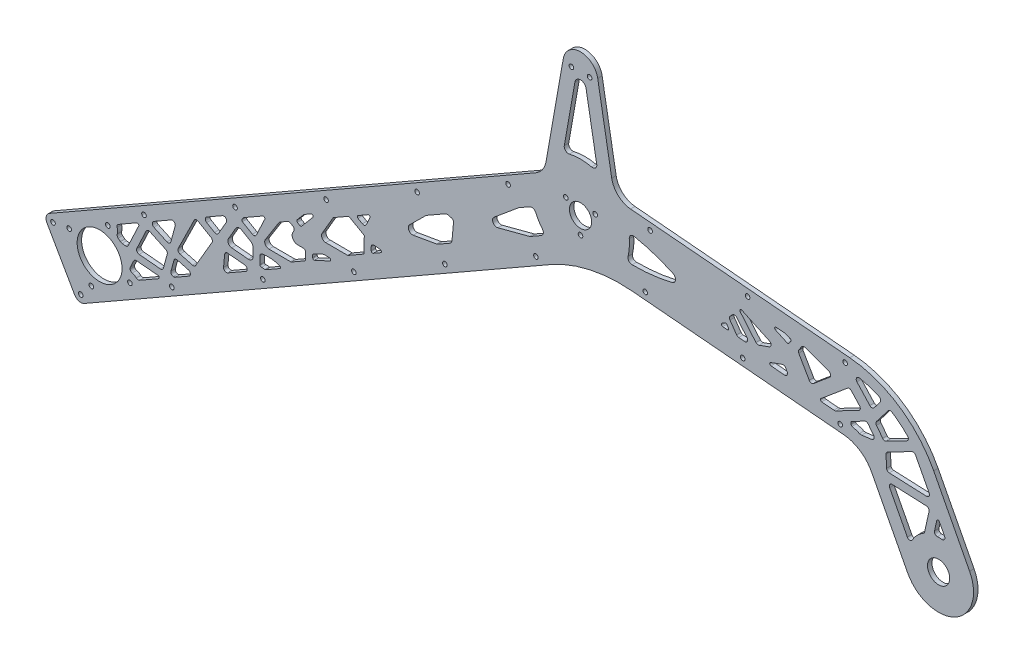
from build123d import *

# Parameters (mm, degrees)
SKETCH2_R              = 7.9375
SKETCH2_R_2            = 16.05
SKETCH2_R_3            = 1.65
BASE_DEPTH             = 3.175
SKETCH3_R              = 1.65
STRUT_HOLES_DEPTH      = 448.434897902
LIGHTENING_HOLES_DEPTH = 448.434897902
SKETCH7_R              = 1.65
CUT_EXTRUDE1_DEPTH     = 448.434897902


with BuildPart() as part:
    # Sketch2 → Base (new body)
    with BuildSketch(Plane.XY):
        with BuildLine():
            Line((-379.716809958, -188.506893436), (-32.006532147, 10.487277971))
            ThreePointArc((-32.006532147, 10.487277971), (-27.186230121, 14.879084252), (-24.685038782, 20.901319377))
            Line((-24.685038782, 20.901319377), (-12.310096913, 91.083102221))
            ThreePointArc((-12.310096913, 91.083102221), (0, 101.4125), (12.310096913, 91.083102221))
            Line((12.310096913, 91.083102221), (22.322003955, 34.302755831))
            ThreePointArc((22.322003955, 34.302755831), (26.960267136, 25.848318444), (35.786784109, 21.964558025))
            Line((35.786784109, 21.964558025), (192.586144941, 8.246391504))
            ThreePointArc((192.586144941, 8.246391504), (227.717231711, -4.10798993), (252.575276723, -31.83706486))
            Line((252.575276723, -31.83706486), (278.255270829, -81.167874559))
            ThreePointArc((278.255270829, -81.167874559), (267.623715331, -114.886860719), (233.904729171, -104.255305221))
            Line((233.904729171, -104.255305221), (208.224735064, -54.924495522))
            ThreePointArc((208.224735064, -54.924495522), (199.93872006, -45.681470545), (188.228357804, -41.563343401))
            Line((188.228357804, -41.563343401), (36.823729736, -28.317154839))
            ThreePointArc((36.823729736, -28.317154839), (6.649577682, -30.266109959), (-21.562664076, -41.144864173))
            Line((-21.562664076, -41.144864173), (-354.881400189, -231.902773674))
            ThreePointArc((-354.881400189, -231.902773674), (-358.677364619, -232.387866435), (-361.70452919, -230.046726627))
            Line((-361.70452919, -230.046726627), (-381.572857005, -195.330022437))
            ThreePointArc((-381.572857005, -195.330022437), (-382.057949767, -191.534058007), (-379.716809958, -188.506893436))
        make_face()
        Circle(SKETCH2_R, mode=Mode.SUBTRACT)
        with Locations((-343.92, -196.825)):
            Circle(SKETCH2_R_2, mode=Mode.SUBTRACT)
        with Locations((-6.5, 88.9125)):
            Circle(SKETCH2_R_3, mode=Mode.SUBTRACT)
        with Locations((6.5, 88.9125)):
            Circle(SKETCH2_R_3, mode=Mode.SUBTRACT)
        with Locations((256.08, -92.71158989)):
            Circle(SKETCH2_R, mode=Mode.SUBTRACT)
        with Locations((-365.631063534, -190.919094461)):
            Circle(SKETCH2_R_3, mode=Mode.SUBTRACT)
        with Locations((-338.014094461, -175.113936466)):
            Circle(SKETCH2_R_3, mode=Mode.SUBTRACT)
        with Locations((-322.208936466, -202.730905539)):
            Circle(SKETCH2_R_3, mode=Mode.SUBTRACT)
        with Locations((-349.825905539, -218.536063534)):
            Circle(SKETCH2_R_3, mode=Mode.SUBTRACT)
    extrude(amount=BASE_DEPTH)

    # Sketch3 → Strut Holes (cut, through all)
    with BuildSketch(Plane.XY.offset(3.175)):
        with Locations((-357.364941166, -227.56318565)):
            Circle(SKETCH3_R)
        with Locations((-292.27112081, -190.310070996)):
            Circle(SKETCH3_R)
        with Locations((-227.177300453, -153.056956343)):
            Circle(SKETCH3_R)
        with Locations((-162.083480097, -115.803841689)):
            Circle(SKETCH3_R)
        with Locations((-96.98965974, -78.550727035)):
            Circle(SKETCH3_R)
        with Locations((-31.895839384, -41.297612382)):
            Circle(SKETCH3_R)
        with Locations((-312.139448625, -155.593366806)):
            Circle(SKETCH3_R)
        with Locations((-377.233268981, -192.84648146)):
            Circle(SKETCH3_R)
        with Locations((-247.045628268, -118.340252152)):
            Circle(SKETCH3_R)
        with Locations((-181.951807912, -81.087137499)):
            Circle(SKETCH3_R)
        with Locations((-116.857987555, -43.834022845)):
            Circle(SKETCH3_R)
        with Locations((-51.764167199, -6.580908192)):
            Circle(SKETCH3_R)
        with Locations((46.269308527, -24.124436716)):
            Circle(SKETCH3_R)
        with Locations((116.002937393, -30.225338708)):
            Circle(SKETCH3_R)
        with Locations((185.73656626, -36.326240701)):
            Circle(SKETCH3_R)
        with Locations((189.222795969, 3.521547223)):
            Circle(SKETCH3_R)
        with Locations((119.489167103, 9.622449215)):
            Circle(SKETCH3_R)
        with Locations((49.755538237, 15.723351208)):
            Circle(SKETCH3_R)
    extrude(amount=-STRUT_HOLES_DEPTH, mode=Mode.SUBTRACT)

    # Sketch6 → Lightening Holes (cut, through all)
    with BuildSketch(Plane.XY.offset(3.175)):
        with BuildLine():
            Line((-315.269185897, -197.710920307), (-301.759255291, -189.979203363))
            ThreePointArc((-301.759255291, -189.979203363), (-301.27885272, -188.89855459), (-302.165025934, -188.115429161))
            Line((-302.165025934, -188.115429161), (-317.529091672, -186.71244549))
            ThreePointArc((-317.529091672, -186.71244549), (-318.704383169, -186.968323474), (-319.520360019, -187.852045956))
            Line((-319.520360019, -187.852045956), (-321.920665487, -192.94890269))
            ThreePointArc((-321.920665487, -192.94890269), (-322.086706026, -193.488507205), (-322.095332893, -194.053014132))
            ThreePointArc((-322.095332893, -194.053014132), (-322.08483495, -194.136958475), (-322.074659882, -194.220942566))
            ThreePointArc((-322.074659882, -194.220942566), (-321.584640098, -195.311697425), (-320.559879114, -195.927920176))
            ThreePointArc((-320.559879114, -195.927920176), (-318.977814459, -196.521247692), (-317.584009883, -197.476378529))
            ThreePointArc((-317.584009883, -197.476378529), (-316.464213346, -197.964897395), (-315.269185897, -197.710920307))
        make_face()
        with BuildLine():
            Line((-289.844978396, -183.160677107), (-279.93882887, -177.491399715))
            ThreePointArc((-279.93882887, -177.491399715), (-278.948378644, -175.502042811), (-280.407275879, -173.825692191))
            Line((-280.407275879, -173.825692191), (-288.292322007, -171.680779414))
            ThreePointArc((-288.292322007, -171.680779414), (-289.810707779, -171.874816518), (-290.747163702, -173.085682346))
            Line((-290.747163702, -173.085682346), (-292.868560549, -180.884280112))
            ThreePointArc((-292.868560549, -180.884280112), (-292.613471256, -182.502456625), (-291.234784363, -183.387209827))
            ThreePointArc((-291.234784363, -183.387209827), (-291.195764259, -183.393163574), (-291.156778347, -183.399337252))
            ThreePointArc((-291.156778347, -183.399337252), (-290.480404568, -183.392541824), (-289.844978396, -183.160677107))
        make_face()
        with BuildLine():
            Line((-225.068253149, -146.0890356), (-215.065938543, -140.36472305))
            ThreePointArc((-215.065938543, -140.36472305), (-214.567033215, -139.40324417), (-215.236329185, -138.55154524))
            ThreePointArc((-215.236329185, -138.55154524), (-221.331874052, -137.268264968), (-227.555460503, -137.531793255))
            ThreePointArc((-227.555460503, -137.531793255), (-228.747493021, -138.209832448), (-229.222550686, -139.49630005))
            Line((-229.222550686, -139.49630005), (-229.243920799, -145.124584195))
            ThreePointArc((-229.243920799, -145.124584195), (-228.903638362, -145.87990104), (-228.110599563, -146.11945299))
            ThreePointArc((-228.110599563, -146.11945299), (-226.935128796, -146.061146676), (-225.766503733, -146.200597789))
            ThreePointArc((-225.766503733, -146.200597789), (-225.407188584, -146.208593442), (-225.068253149, -146.0890356))
        make_face()
        with BuildLine():
            Line((-202.41887229, -105.511400104), (-200.686234771, -106.520529682))
            ThreePointArc((-200.686234771, -106.520529682), (-200.013042452, -106.64186894), (-199.419351845, -106.302100524))
            Line((-199.419351845, -106.302100524), (-191.360868047, -96.772094027))
            ThreePointArc((-191.360868047, -96.772094027), (-191.355986863, -95.486528074), (-192.621174572, -95.258484862))
            Line((-192.621174572, -95.258484862), (-197.478989202, -98.038606299))
            ThreePointArc((-197.478989202, -98.038606299), (-197.765321596, -98.237482482), (-198.01276947, -98.483058387))
            Line((-198.01276947, -98.483058387), (-202.679186023, -104.001587826))
            ThreePointArc((-202.679186023, -104.001587826), (-202.901047671, -104.817187109), (-202.41887229, -105.511400104))
        make_face()
        with BuildLine():
            Line((-330.425499061, -170.667183769), (-317.378257487, -163.200263197))
            ThreePointArc((-317.378257487, -163.200263197), (-316.203164595, -163.333473919), (-315.976852671, -164.494237166))
            Line((-315.976852671, -164.494237166), (-323.402158767, -180.26128093))
            ThreePointArc((-323.402158767, -180.26128093), (-324.218135617, -181.145003412), (-325.393427114, -181.400881396))
            Line((-325.393427114, -181.400881396), (-327.826064744, -181.178742873))
            ThreePointArc((-327.826064744, -181.178742873), (-328.456346912, -181.014705953), (-329.000507167, -180.656860539))
            ThreePointArc((-329.000507167, -180.656860539), (-329.788551481, -179.963737807), (-330.608754561, -179.308986045))
            ThreePointArc((-330.608754561, -179.308986045), (-331.300981929, -178.333954341), (-331.313186478, -177.138246768))
            ThreePointArc((-331.313186478, -177.138246768), (-331.014233087, -175.069882607), (-331.339196402, -173.005445087))
            ThreePointArc((-331.339196402, -173.005445087), (-331.294912573, -171.675100882), (-330.425499061, -170.667183769))
        make_face()
        with BuildLine():
            Line((-295.53330948, -171.631597975), (-298.296173769, -181.788333758))
            ThreePointArc((-298.296173769, -181.788333758), (-299.085121934, -182.906012266), (-300.407921189, -183.255077571))
            Line((-300.407921189, -183.255077571), (-315.662540801, -181.862088072))
            ThreePointArc((-315.662540801, -181.862088072), (-317.216500905, -180.86379127), (-317.290058936, -179.018262152))
            Line((-317.290058936, -179.018262152), (-310.641451377, -164.900475625))
            ThreePointArc((-310.641451377, -164.900475625), (-309.508957679, -163.870619434), (-307.979945409, -163.943195111))
            Line((-307.979945409, -163.943195111), (-296.611069066, -169.297235353))
            ThreePointArc((-296.611069066, -169.297235353), (-295.647370018, -170.26828046), (-295.53330948, -171.631597975))
        make_face()
        with BuildLine():
            Line((-292.778723285, -149.121979529), (-305.215642876, -156.239613568))
            ThreePointArc((-305.215642876, -156.239613568), (-306.220639762, -158.055100377), (-305.074339213, -159.784842018))
            Line((-305.074339213, -159.784842018), (-295.766029178, -164.168482495))
            ThreePointArc((-295.766029178, -164.168482495), (-294.075568316, -164.17490103), (-292.984044137, -162.884058635))
            Line((-292.984044137, -162.884058635), (-289.85543458, -151.38278412))
            ThreePointArc((-289.85543458, -151.38278412), (-290.561768266, -149.275742292), (-292.778723285, -149.121979529))
        make_face()
        with BuildLine():
            Line((-286.412158457, -167.010536912), (-277.477694151, -169.440915421))
            ThreePointArc((-277.477694151, -169.440915421), (-276.194379154, -169.361694864), (-275.224483334, -168.5176123))
            Line((-275.224483334, -168.5176123), (-263.487039881, -148.364863469))
            ThreePointArc((-263.487039881, -148.364863469), (-263.281478176, -146.847994939), (-264.208712124, -145.63005284))
            Line((-264.208712124, -145.63005284), (-273.491108909, -140.223762697))
            ThreePointArc((-273.491108909, -140.223762697), (-275.075155334, -140.037188202), (-276.291924346, -141.06844292))
            Line((-276.291924346, -141.06844292), (-287.68143532, -164.197103385))
            ThreePointArc((-287.68143532, -164.197103385), (-287.710247586, -165.903135064), (-286.412158457, -167.010536912))
        make_face()
        with BuildLine():
            Line((-267.326941544, -134.555955625), (-255.981699002, -128.063087041))
            ThreePointArc((-255.981699002, -128.063087041), (-253.568709634, -128.390088491), (-253.260041176, -130.805491443))
            Line((-253.260041176, -130.805491443), (-258.957478514, -140.587777008))
            ThreePointArc((-258.957478514, -140.587777008), (-260.175420613, -141.515010956), (-261.692289142, -141.309449251))
            Line((-261.692289142, -141.309449251), (-267.340094346, -138.02003227))
            ThreePointArc((-267.340094346, -138.02003227), (-268.333510737, -136.284197061), (-267.326941544, -134.555955625))
        make_face()
        with BuildLine():
            Line((-255.261313261, -159.742391016), (-254.488576255, -151.280152708))
            ThreePointArc((-254.488576255, -151.280152708), (-253.776611846, -149.925068788), (-252.314987955, -149.470314621))
            Line((-252.314987955, -149.470314621), (-240.229659184, -150.573897437))
            ThreePointArc((-240.229659184, -150.573897437), (-238.457312757, -152.140148294), (-239.418117899, -154.30144584))
            Line((-239.418117899, -154.30144584), (-252.276183677, -161.660101332))
            ThreePointArc((-252.276183677, -161.660101332), (-254.350596062, -161.606956723), (-255.261313261, -159.742391016))
        make_face()
        with BuildLine():
            Line((-246.540160509, -131.189393308), (-251.794794147, -140.211401578))
            ThreePointArc((-251.794794147, -140.211401578), (-251.868704934, -143.096387582), (-249.475244653, -144.708825158))
            Line((-249.475244653, -144.708825158), (-237.508018237, -145.801623349))
            ThreePointArc((-237.508018237, -145.801623349), (-235.21684764, -145.033565045), (-234.235227202, -142.825444219))
            Line((-234.235227202, -142.825444219), (-234.211718457, -136.633904573))
            ThreePointArc((-234.211718457, -136.633904573), (-234.607944018, -135.132389326), (-235.701843043, -134.030151758))
            Line((-235.701843043, -134.030151758), (-242.437944567, -130.106884943))
            ThreePointArc((-242.437944567, -130.106884943), (-244.713247361, -129.798542386), (-246.540160509, -131.189393308))
        make_face()
        with BuildLine():
            Line((-241.753564235, -124.719255848), (-234.63976684, -128.862501783))
            ThreePointArc((-234.63976684, -128.862501783), (-233.039032694, -129.043963991), (-231.823804406, -127.986373074))
            Line((-231.823804406, -127.986373074), (-225.796901327, -115.1887263))
            ThreePointArc((-225.796901327, -115.1887263), (-226.023213251, -114.027963054), (-227.198306143, -113.894752332))
            Line((-227.198306143, -113.894752332), (-240.486863137, -121.499777426))
            ThreePointArc((-240.486863137, -121.499777426), (-240.868014227, -121.782834524), (-241.171709307, -122.147754751))
            ThreePointArc((-241.171709307, -122.147754751), (-241.549582312, -122.675396768), (-241.974698217, -123.165774758))
            ThreePointArc((-241.974698217, -123.165774758), (-242.240299662, -123.996061899), (-241.753564235, -124.719255848))
        make_face()
        with BuildLine():
            Line((-215.668807888, -112.174898455), (-225.379976009, -127.585503674))
            ThreePointArc((-225.379976009, -127.585503674), (-225.4712487, -130.629365716), (-222.853276851, -132.184888211))
            Line((-222.853276851, -132.184888211), (-207.454371398, -132.243356535))
            ThreePointArc((-207.454371398, -132.243356535), (-206.936478287, -132.177174092), (-206.453361233, -131.979206161))
            Line((-206.453361233, -131.979206161), (-197.505650544, -126.858442157))
            ThreePointArc((-197.505650544, -126.858442157), (-196.770825499, -126.12917614), (-196.499081351, -125.130200721))
            Line((-196.499081351, -125.130200721), (-196.484480993, -121.28487852))
            ThreePointArc((-196.484480993, -121.28487852), (-197.064893599, -119.868450986), (-198.476872802, -119.277299162))
            Line((-198.476872802, -119.277299162), (-202.260748213, -119.262932112))
            ThreePointArc((-202.260748213, -119.262932112), (-205.751377346, -117.188902119), (-205.629680425, -113.130419396))
            Line((-205.629680425, -113.130419396), (-205.026921593, -112.173904352))
            ThreePointArc((-205.026921593, -112.173904352), (-204.776566908, -110.63116148), (-205.712412279, -109.379392142))
            Line((-205.712412279, -109.379392142), (-207.46181523, -108.360497976))
            ThreePointArc((-207.46181523, -108.360497976), (-208.460790649, -108.088753828), (-209.461800813, -108.352904202))
            Line((-209.461800813, -108.352904202), (-214.9701644, -111.50533402))
            ThreePointArc((-214.9701644, -111.50533402), (-215.360592232, -111.79722492), (-215.668807888, -112.174898455))
        make_face()
        with BuildLine():
            Line((-191.479772218, -120.054212502), (-191.486581073, -121.847472571))
            ThreePointArc((-191.486581073, -121.847472571), (-191.027086278, -122.692614758), (-190.067414214, -122.759175345))
            Line((-190.067414214, -122.759175345), (-179.245533818, -117.762785652))
            ThreePointArc((-179.245533818, -117.762785652), (-178.687597118, -116.642148596), (-179.660910998, -115.854886972))
            Line((-179.660910998, -115.854886972), (-183.284876561, -115.841127086))
            ThreePointArc((-183.284876561, -115.841127086), (-183.717932672, -115.886891136), (-184.13081847, -116.025300894))
            Line((-184.13081847, -116.025300894), (-190.898953493, -119.150103501))
            ThreePointArc((-190.898953493, -119.150103501), (-191.321124727, -119.517511391), (-191.479772218, -120.054212502))
        make_face()
        with BuildLine():
            Line((-166.401123038, -107.905175585), (-182.204856698, -107.845170163))
            ThreePointArc((-182.204856698, -107.845170163), (-184.797218852, -106.335316373), (-184.785828191, -103.335337998))
            Line((-184.785828191, -103.335337998), (-176.831995141, -89.678905885))
            Line((-176.831995141, -89.678905885), (-165.638950905, -83.273140207))
            Line((-165.638950905, -83.273140207), (-154.64049223, -89.678905885))
            Line((-154.64049223, -89.678905885), (-154.684235374, -101.199614947))
            Line((-154.684235374, -101.199614947), (-166.401123038, -107.905175585))
        make_face()
        with BuildLine():
            Line((-149.666734346, -96.599830521), (-149.657550536, -94.181074309))
            ThreePointArc((-149.657550536, -94.181074309), (-149.003136911, -92.708993759), (-147.475689846, -92.196954889))
            Line((-147.475689846, -92.196954889), (-143.284670701, -92.579661624))
            ThreePointArc((-143.284670701, -92.579661624), (-142.398497488, -93.362787052), (-142.878900059, -94.443435825))
            Line((-142.878900059, -94.443435825), (-148.170033359, -97.471545013))
            ThreePointArc((-148.170033359, -97.471545013), (-149.170026151, -97.467748126), (-149.666734346, -96.599830521))
        make_face()
        with BuildLine():
            Line((-159.124748889, -79.545070273), (-152.013980011, -75.475585845))
            ThreePointArc((-152.013980011, -75.475585845), (-150.838887119, -75.608796567), (-150.612575195, -76.769559813))
            Line((-150.612575195, -76.769559813), (-153.182146906, -82.225839878))
            ThreePointArc((-153.182146906, -82.225839878), (-154.397375194, -83.283430795), (-155.99810934, -83.101968586))
            Line((-155.99810934, -83.101968586), (-159.13132529, -81.277108596))
            ThreePointArc((-159.13132529, -81.277108596), (-159.628033486, -80.409190991), (-159.124748889, -79.545070273))
        make_face()
        with BuildLine():
            Line((-90.819864813, -49.698540482), (-91.896421351, -61.487904644))
            ThreePointArc((-91.896421351, -61.487904644), (-92.359955239, -62.836585977), (-93.393866555, -63.818844799))
            Line((-93.393866555, -63.818844799), (-101.994338017, -68.740884214))
            ThreePointArc((-101.994338017, -68.740884214), (-102.469113289, -68.960084777), (-102.974739436, -69.09351133))
            Line((-102.974739436, -69.09351133), (-119.629879497, -71.965101226))
            ThreePointArc((-119.629879497, -71.965101226), (-122.805875604, -70.383853511), (-122.252853304, -66.87936183))
            Line((-122.252853304, -66.87936183), (-110.681116507, -55.395166432))
            ThreePointArc((-110.681116507, -55.395166432), (-110.385100172, -55.137548838), (-110.057990454, -54.920773084))
            Line((-110.057990454, -54.920773084), (-96.724691463, -47.290142199))
            ThreePointArc((-96.724691463, -47.290142199), (-95.614849419, -46.918095089), (-94.447112805, -46.999086542))
            Line((-94.447112805, -46.999086542), (-92.286608626, -47.586793062))
            ThreePointArc((-92.286608626, -47.586793062), (-91.168930118, -48.375741228), (-90.819864813, -49.698540482))
        make_face()
        with BuildLine():
            Line((-28.096781534, -26.449402024), (-35.825401618, -30.87248195))
            ThreePointArc((-35.825401618, -30.87248195), (-36.178007781, -31.044706772), (-36.550077199, -31.169433846))
            Line((-36.550077199, -31.169433846), (-59.133973609, -37.128958431))
            ThreePointArc((-59.133973609, -37.128958431), (-62.565695554, -35.603385935), (-61.819045791, -31.92281518))
            Line((-61.819045791, -31.92281518), (-44.317223042, -17.349924163))
            ThreePointArc((-44.317223042, -17.349924163), (-44.108986088, -17.191390869), (-43.887724451, -17.051609889))
            Line((-43.887724451, -17.051609889), (-36.274597881, -12.694626761))
            ThreePointArc((-36.274597881, -12.694626761), (-33.845543285, -12.449097133), (-32.038330666, -14.090612767))
            ThreePointArc((-32.038330666, -14.090612767), (-29.904900702, -18.185073934), (-27.251097742, -21.963097956))
            ThreePointArc((-27.251097742, -21.963097956), (-26.638826778, -24.401372335), (-28.096781534, -26.449402024))
        make_face()
        with BuildLine():
            Line((-11.599665343, 37.524455033), (-3.986146646, 80.702865203))
            ThreePointArc((-3.986146646, 80.702865203), (0, 84.047639383), (3.986146646, 80.702865203))
            Line((3.986146646, 80.702865203), (11.599665343, 37.524455033))
            ThreePointArc((11.599665343, 37.524455033), (10.707449692, 34.824680589), (7.962722972, 34.082180723))
            ThreePointArc((7.962722972, 34.082180723), (0, 35), (-7.962722972, 34.082180723))
            ThreePointArc((-7.962722972, 34.082180723), (-10.707449692, 34.824680589), (-11.599665343, 37.524455033))
        make_face()
        with BuildLine():
            Line((246.075987756, -72.913561708), (249.254007124, -58.57844272))
            ThreePointArc((249.254007124, -58.57844272), (248.888121791, -56.928040634), (247.388653885, -56.147467049))
            Line((247.388653885, -56.147467049), (222.962162816, -55.080983417))
            ThreePointArc((222.962162816, -55.080983417), (221.188141149, -56.004480644), (221.100902375, -58.002577087))
            Line((221.100902375, -58.002577087), (233.735290203, -82.273010289))
            ThreePointArc((233.735290203, -82.273010289), (235.484637714, -83.349360854), (237.260008731, -82.316498325))
            ThreePointArc((237.260008731, -82.316498325), (240.657318696, -77.731906936), (245.140979083, -74.202461834))
            ThreePointArc((245.140979083, -74.202461834), (245.742284649, -73.655075389), (246.075987756, -72.913561708))
        make_face()
        with BuildLine():
            Line((253.133679234, -68.799730633), (254.751992566, -61.499990928))
            ThreePointArc((254.751992566, -61.499990928), (255.597762381, -60.72498568), (256.615299406, -61.254681929))
            Line((256.615299406, -61.254681929), (260.345615198, -68.420551892))
            ThreePointArc((260.345615198, -68.420551892), (260.223925452, -70.470902803), (258.359543018, -71.332775993))
            ThreePointArc((258.359543018, -71.332775993), (256.767087179, -71.222571503), (255.170843908, -71.230820928))
            ThreePointArc((255.170843908, -71.230820928), (253.553325039, -70.51716267), (253.133679234, -68.799730633))
        make_face()
        with BuildLine():
            Line((249.310771487, -47.22281435), (239.59747458, -28.563744597))
            ThreePointArc((239.59747458, -28.563744597), (238.424864512, -27.579807922), (236.899955687, -27.713220157))
            Line((236.899955687, -27.713220157), (219.565597936, -36.736915644))
            ThreePointArc((219.565597936, -36.736915644), (218.757044355, -37.510937311), (218.490998719, -38.598176086))
            Line((218.490998719, -38.598176086), (218.860832904, -47.068771554))
            ThreePointArc((218.860832904, -47.068771554), (219.444715785, -48.395746342), (220.771690573, -48.979629223))
            Line((220.771690573, -48.979629223), (247.449511046, -50.144408019))
            ThreePointArc((247.449511046, -50.144408019), (249.223532712, -49.220910793), (249.310771487, -47.22281435))
        make_face()
        with BuildLine():
            Line((233.413458883, -22.763883833), (218.618137266, -30.46584077))
            ThreePointArc((218.618137266, -30.46584077), (217.261760811, -30.644411118), (216.107933359, -29.909341962))
            Line((216.107933359, -29.909341962), (211.671799483, -24.128059737))
            ThreePointArc((211.671799483, -24.128059737), (211.258506163, -22.910536879), (211.671799483, -21.693014021))
            Line((211.671799483, -21.693014021), (220.007167815, -10.830150518))
            ThreePointArc((220.007167815, -10.830150518), (221.257760997, -10.076118732), (222.687548657, -10.3731953))
            ThreePointArc((222.687548657, -10.3731953), (228.553817552, -14.676513168), (233.918900039, -19.590528361))
            ThreePointArc((233.918900039, -19.590528361), (234.465065341, -21.304449895), (233.413458883, -22.763883833))
        make_face()
        with BuildLine():
            Line((209.61657846, -31.305721344), (205.746256457, -26.261819508))
            ThreePointArc((205.746256457, -26.261819508), (204.592429004, -25.526750352), (203.23605255, -25.7053207))
            Line((203.23605255, -25.7053207), (194.010059092, -30.508068903))
            ThreePointArc((194.010059092, -30.508068903), (193.616895834, -30.876306478), (193.471807705, -31.395079736))
            Line((193.471807705, -31.395079736), (193.471807705, -32.496691451))
            ThreePointArc((193.471807705, -32.496691451), (193.684204256, -33.112873898), (194.23116932, -33.467306291))
            ThreePointArc((194.23116932, -33.467306291), (196.89746606, -34.245224393), (199.491371204, -35.238175037))
            ThreePointArc((199.491371204, -35.238175037), (200.2654041, -35.454155852), (201.069000396, -35.456918226))
            Line((201.069000396, -35.456918226), (208.290924164, -34.506133925))
            ThreePointArc((208.290924164, -34.506133925), (209.877630844, -33.288611067), (209.61657846, -31.305721344))
        make_face()
        with BuildLine():
            Line((214.303083467, -8.407780179), (209.957683706, -14.070815403))
            ThreePointArc((209.957683706, -14.070815403), (208.4582158, -14.851388988), (206.896422352, -14.20447296))
            Line((206.896422352, -14.20447296), (197.688681904, -4.155987535))
            ThreePointArc((197.688681904, -4.155987535), (197.423723958, -1.817844179), (199.566737265, -0.845933158))
            ThreePointArc((199.566737265, -0.845933158), (206.676023639, -2.722269436), (213.536897173, -5.366320289))
            ThreePointArc((213.536897173, -5.366320289), (214.655785228, -6.701693203), (214.303083467, -8.407780179))
        make_face()
        with BuildLine():
            Line((193.681402215, -11.624307007), (199.545514004, -18.023862053))
            ThreePointArc((199.545514004, -18.023862053), (200.040574836, -19.722338824), (198.994456557, -21.149064135))
            Line((198.994456557, -21.149064135), (182.807531418, -29.575444012))
            ThreePointArc((182.807531418, -29.575444012), (182.007556544, -29.856767353), (181.16081835, -29.902995606))
            Line((181.16081835, -29.902995606), (172.48260155, -29.143750017))
            ThreePointArc((172.48260155, -29.143750017), (171.616040342, -28.448261118), (171.926969683, -27.381510875))
            Line((171.926969683, -27.381510875), (190.921272322, -11.443398536))
            ThreePointArc((190.921272322, -11.443398536), (192.3376538, -10.979769576), (193.681402215, -11.624307007))
        make_face()
        with BuildLine():
            Line((178.199205815, -11.022517891), (166.591800736, -20.762287211))
            ThreePointArc((166.591800736, -20.762287211), (164.958929162, -21.199813831), (163.574174709, -20.230198325))
            Line((163.574174709, -20.230198325), (156.047951006, -7.194396481))
            ThreePointArc((156.047951006, -7.194396481), (155.78190537, -6.107157706), (156.141697725, -5.047243608))
            Line((156.141697725, -5.047243608), (158.18845934, -2.124165087))
            ThreePointArc((158.18845934, -2.124165087), (159.22535183, -1.363884058), (160.510803716, -1.391932718))
            Line((160.510803716, -1.391932718), (177.597670882, -7.611043763))
            ThreePointArc((177.597670882, -7.611043763), (178.883246101, -9.143132649), (178.199205815, -11.022517891))
        make_face()
        with BuildLine():
            Line((146.644806866, -20.907673079), (147.746965574, -22.816667961))
            ThreePointArc((147.746965574, -22.816667961), (147.701697658, -24.891267177), (145.840603281, -25.809057357))
            Line((145.840603281, -25.809057357), (136.229987031, -24.968237386))
            ThreePointArc((136.229987031, -24.968237386), (135.325697913, -24.10256888), (135.975122631, -23.032350067))
            Line((135.975122631, -23.032350067), (144.228715771, -20.028287838))
            ThreePointArc((144.228715771, -20.028287838), (145.596796345, -20.028287838), (146.644806866, -20.907673079))
        make_face()
        with BuildLine():
            Line((134.974345297, -13.819003275), (127.671845659, -16.476895779))
            ThreePointArc((127.671845659, -16.476895779), (126.470167282, -16.52936219), (125.455716486, -15.883085757))
            Line((125.455716486, -15.883085757), (114.198527576, -2.46729043))
            ThreePointArc((114.198527576, -2.46729043), (114.171218678, -1.215741392), (115.387190281, -0.918195034))
            Line((115.387190281, -0.918195034), (135.135541534, -10.127002459))
            ThreePointArc((135.135541534, -10.127002459), (136.288401454, -12.026856808), (134.974345297, -13.819003275))
        make_face()
        with BuildLine():
            Line((139.430597275, -1.096040654), (147.83182135, -5.013595778))
            ThreePointArc((147.83182135, -5.013595778), (148.513258657, -5.073213817), (149.073591656, -4.680864427))
            Line((149.073591656, -4.680864427), (150.425898479, -2.749570135))
            ThreePointArc((150.425898479, -2.749570135), (150.560463385, -1.875287899), (149.948766578, -1.236301077))
            Line((149.948766578, -1.236301077), (146.098496258, 0.165082713))
            ThreePointArc((146.098496258, 0.165082713), (145.72175467, 0.274892872), (145.333903056, 0.334588945))
            Line((145.333903056, 0.334588945), (139.940371279, 0.806461832))
            ThreePointArc((139.940371279, 0.806461832), (138.88728971, 0.069086179), (139.430597275, -1.096040654))
        make_face()
        with BuildLine():
            Line((111.660494937, -7.221200049), (119.04545342, -16.022250853))
            ThreePointArc((119.04545342, -16.022250853), (119.2873862, -18.231323299), (117.339053048, -19.300215468))
            Line((117.339053048, -19.300215468), (113.116226003, -18.930765974))
            ThreePointArc((113.116226003, -18.930765974), (112.290537488, -18.670427385), (111.6522334, -18.08552945))
            Line((111.6522334, -18.08552945), (106.877510971, -11.266519132))
            ThreePointArc((106.877510971, -11.266519132), (106.523425664, -9.945054773), (107.101601497, -8.705152697))
            Line((107.101601497, -8.705152697), (108.714192488, -7.092561706))
            ThreePointArc((108.714192488, -7.092561706), (110.215644825, -6.508678825), (111.660494937, -7.221200049))
        make_face()
        with BuildLine():
            Line((104.703890017, -15.136053881), (105.75536165, -16.637710998))
            ThreePointArc((105.75536165, -16.637710998), (105.80223501, -17.711287434), (104.849053863, -18.207482132))
            Line((104.849053863, -18.207482132), (101.67727128, -17.929987113))
            ThreePointArc((101.67727128, -17.929987113), (100.788131016, -17.150232029), (101.264427023, -16.067767011))
            Line((101.264427023, -16.067767011), (103.384737973, -14.843604914))
            ThreePointArc((103.384737973, -14.843604914), (104.101177587, -14.73333431), (104.703890017, -15.136053881))
        make_face()
        with BuildLine():
            ThreePointArc((34.863622447, 3.086718303), (34.900341082, -2.63935454), (34.002891304, -8.294780463))
            ThreePointArc((34.002891304, -8.294780463), (34.552114447, -10.851108963), (36.89804352, -12.005699039))
            ThreePointArc((36.89804352, -12.005699039), (51.290024205, -11.233136631), (65.485577957, -8.740705208))
            ThreePointArc((65.485577957, -8.740705208), (67.910545504, -5.973310403), (66.09771963, -2.77134164))
            ThreePointArc((66.09771963, -2.77134164), (52.541526947, 2.603547383), (38.433463256, 6.29439159))
            ThreePointArc((38.433463256, 6.29439159), (35.846829531, 5.582787002), (34.863622447, 3.086718303))
        make_face()
    extrude(amount=-LIGHTENING_HOLES_DEPTH, mode=Mode.SUBTRACT)

    # Sketch7 → Cut-Extrude1 (cut, through all)
    with BuildSketch(Plane.XY.offset(3.175)):
        with Locations((-10.5, 6.062177826)):
            Circle(SKETCH7_R)
        with Locations((10.5, 6.062177826)):
            Circle(SKETCH7_R)
        with Locations((0, -12.124355653)):
            Circle(SKETCH7_R)
    extrude(amount=-CUT_EXTRUDE1_DEPTH, mode=Mode.SUBTRACT)


solid = part.part
